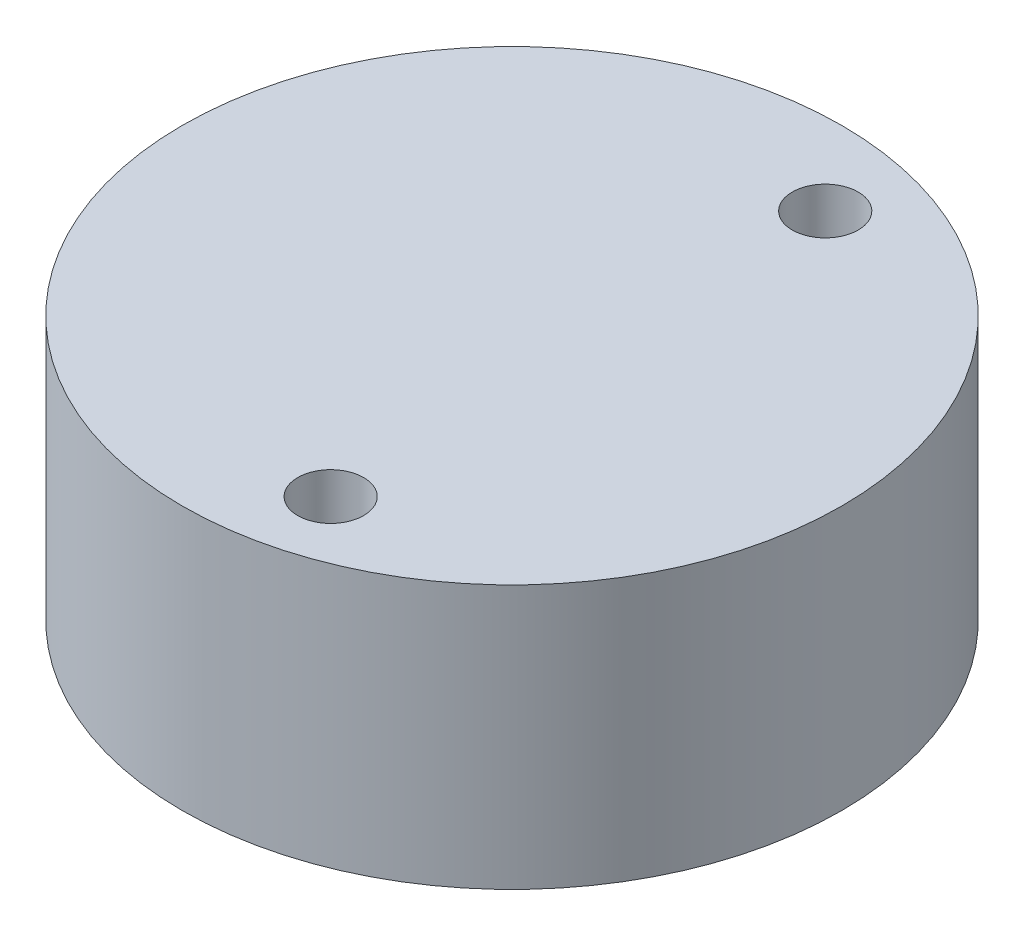
from build123d import *

# Parameters (mm, degrees)
SKETCH1_R           = 5
SKETCH1_R_2         = 3
BOSS_EXTRUDE1_DEPTH = 2
SKETCH2_R           = 5
BOSS_EXTRUDE2_DEPTH = 2
SKETCH3_R           = 0.5
CUT_EXTRUDE1_DEPTH  = 9.774964387


with BuildPart() as part:
    # Sketch1 → Boss-Extrude1 (new body)
    with BuildSketch(Plane(origin=(0, 0, 0), x_dir=(1, 0, 0), z_dir=(0, 1, 0))):
        with Locations((-1, 0)):
            Circle(SKETCH1_R)
        Circle(SKETCH1_R_2, mode=Mode.SUBTRACT)
    extrude(amount=BOSS_EXTRUDE1_DEPTH)

    # Sketch2 → Boss-Extrude2 (add)
    with BuildSketch(Plane(origin=(0, 2, 0), x_dir=(1, 0, 0), z_dir=(0, 1, 0))):
        with Locations((-1, 0)):
            Circle(SKETCH2_R)
    extrude(amount=BOSS_EXTRUDE2_DEPTH)

    # Sketch3 → Cut-Extrude1 (cut, through all)
    with BuildSketch(Plane.XZ):
        with Locations((0, 3.75)):
            Circle(SKETCH3_R)
        with Locations((0, -3.75)):
            Circle(SKETCH3_R)
    extrude(amount=-CUT_EXTRUDE1_DEPTH, mode=Mode.SUBTRACT)


solid = part.part
